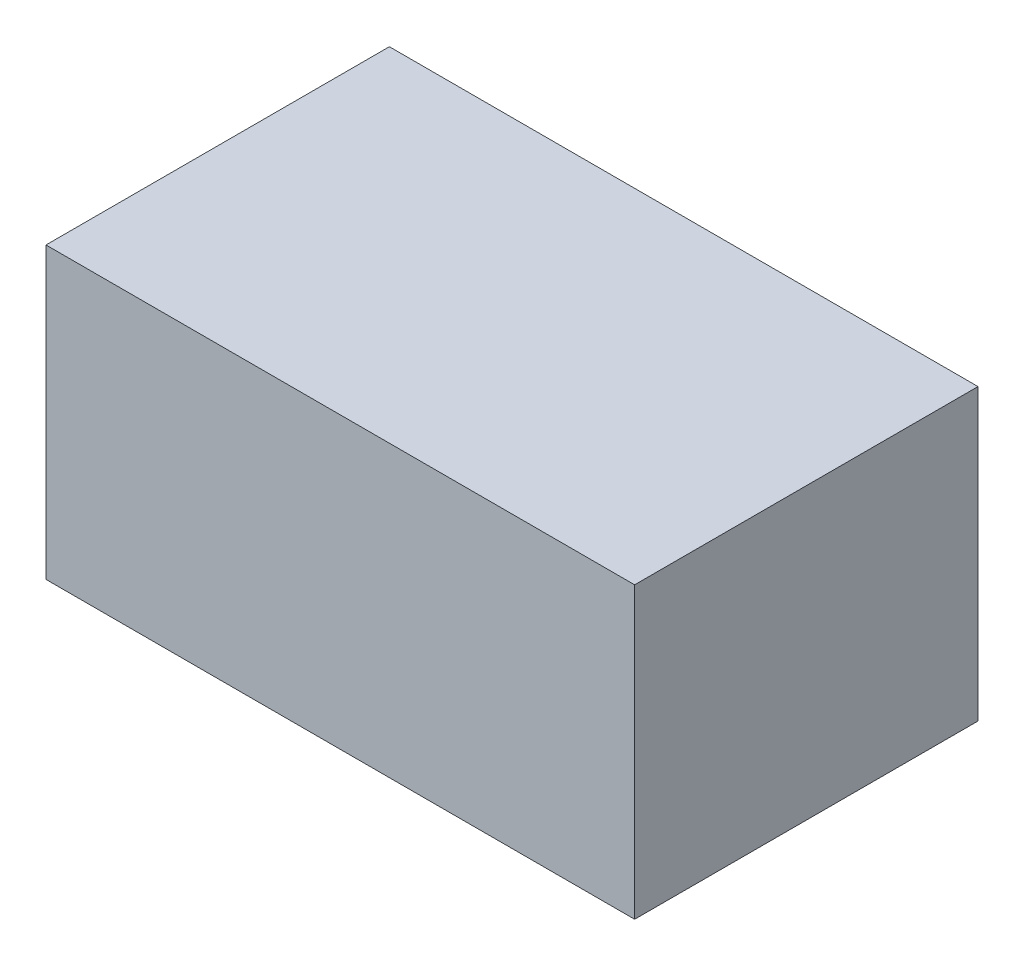
from build123d import *

# Parameters (mm, degrees)
SKETCH1_W           = 1524
SKETCH1_H           = 889
BOSS_EXTRUDE1_DEPTH = 750


with BuildPart() as part:
    # Sketch1 → Boss-Extrude1 (new body)
    with BuildSketch(Plane(origin=(0, 0, 0), x_dir=(1, 0, 0), z_dir=(0, 1, 0))):
        Rectangle(SKETCH1_W, SKETCH1_H)
    extrude(amount=BOSS_EXTRUDE1_DEPTH)


solid = part.part
